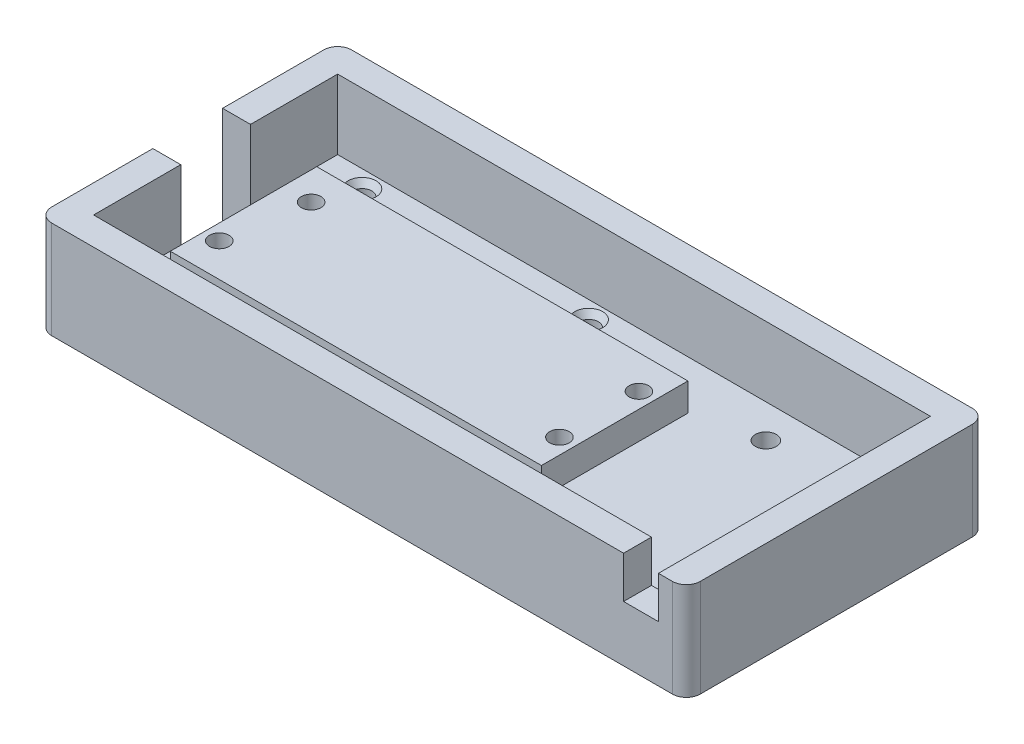
from build123d import *
from OCP.BRepFilletAPI import BRepFilletAPI_MakeChamfer

# Parameters (mm, degrees)
SKETCH1_W               = 93
SKETCH1_H               = 43
SKETCH1_R               = 1.4
SKETCH1_W_2             = 51
SKETCH1_H_2             = 21
SKETCH1_W_3             = 21
SKETCH1_H_3             = 34
BOSS_EXTRUDE1_DEPTH     = 4
BOSS_EXTRUDE2_OUTLINE_W = 53.222222222
BOSS_EXTRUDE2_OUTLINE_H = 21
BOSS_EXTRUDE2_OUTLINE_R = 1.4
BOSS_EXTRUDE2_DEPTH     = 8
SKETCH1_4_W             = 21
SKETCH1_4_H             = 34
SKETCH1_4_R             = 1.5
BOSS_EXTRUDE3_DEPTH     = 4
CHAMFER1_SIZE           = 0.6
CHAMFER1_SIZE2          = 0.960200717
SKETCH2_W               = 10
SKETCH2_H               = 10
CUT_EXTRUDE1_DEPTH      = 4
BOSS_EXTRUDE4_DEPTH     = 10
FILLET1_R               = 2
SKETCH5_W               = 5
SKETCH5_H               = 4
CUT_EXTRUDE3_DEPTH      = 6


# Read off the part's stored shape, not the designer's step: Boss-Extrude2
with BuildPart() as part:
    # Sketch1 → Boss-Extrude1 (new body)
    with BuildSketch(Plane(origin=(0, 0, 0), x_dir=(1, 0, 0), z_dir=(0, 1, 0))):
        with Locations((46.5, 21.5)):
            Rectangle(SKETCH1_W, SKETCH1_H)
        with Locations(Location((10, 36.5, 0), (0, 0, 270))):
            Circle(SKETCH1_R, mode=Mode.SUBTRACT)
        with Locations(Location((42.5, 36.5, 0), (0, 0, 270))):
            Circle(SKETCH1_R, mode=Mode.SUBTRACT)
        with Locations(Location((42.5, 6.5, 0), (0, 0, 270))):
            Circle(SKETCH1_R, mode=Mode.SUBTRACT)
        with Locations(Location((10, 6.5, 0), (0, 0, 270))):
            Circle(SKETCH1_R, mode=Mode.SUBTRACT)
        with Locations((35.5, 21.5)):
            Rectangle(SKETCH1_W_2, SKETCH1_H_2, mode=Mode.SUBTRACT)
        with Locations((77.5, 21.5)):
            Rectangle(SKETCH1_W_3, SKETCH1_H_3, mode=Mode.SUBTRACT)
    extrude(amount=BOSS_EXTRUDE1_DEPTH)

    # Boss-Extrude2 outline → Boss-Extrude2 (add)
    with BuildSketch(Plane(origin=(0, 0, 0), x_dir=(1, 0, 0), z_dir=(0, 1, 0))):
        with Locations((34.611111111, 21.5)):
            Rectangle(BOSS_EXTRUDE2_OUTLINE_W, BOSS_EXTRUDE2_OUTLINE_H)
        with Locations((10.222222222, 15.8)):
            Circle(BOSS_EXTRUDE2_OUTLINE_R, mode=Mode.SUBTRACT)
        with Locations((12, 27.2)):
            Circle(BOSS_EXTRUDE2_OUTLINE_R, mode=Mode.SUBTRACT)
        with Locations((59, 27.2)):
            Circle(BOSS_EXTRUDE2_OUTLINE_R, mode=Mode.SUBTRACT)
        with Locations((59, 15.8)):
            Circle(BOSS_EXTRUDE2_OUTLINE_R, mode=Mode.SUBTRACT)
    extrude(amount=BOSS_EXTRUDE2_DEPTH)

    # Sketch1<4> → Boss-Extrude3 (add)
    with BuildSketch(Plane(origin=(0, 0, 0), x_dir=(1, 0, 0), z_dir=(0, 1, 0))):
        with Locations((77.5, 21.5)):
            Rectangle(SKETCH1_4_W, SKETCH1_4_H)
        with Locations(Location((70.2, 34.2, 0), (0, 0, 270))):
            Circle(SKETCH1_4_R, mode=Mode.SUBTRACT)
        with Locations(Location((84.8, 34.2, 0), (0, 0, 270))):
            Circle(SKETCH1_4_R, mode=Mode.SUBTRACT)
    extrude(amount=BOSS_EXTRUDE3_DEPTH)

    # Chamfer1: one chamfer whose edges measure the first distance from different faces: ONE call of the kernel's chamfer builder (chamfer() names one face for all edges)
    chamfer1_edges_1 = [part.edges().sort_by_distance(p)[0] for p in [
        (42.5, 4, -7.9),
    ]]
    chamfer1_side_1 = [part.faces().sort_by_distance(p)[0] for p in [
        (42.5, 2, -7.9),
    ]]
    chamfer1_edges_2 = [part.edges().sort_by_distance(p)[0] for p in [
        (42.5, 4, -37.9),
        (10, 4, -37.9),
    ]]
    chamfer1_side_2 = [part.faces().sort_by_distance(p)[0] for p in [
        (46.5, 4, -1.024597482),
    ]]
    chamfer1_edges_3 = [part.edges().sort_by_distance(p)[0] for p in [
        (10, 4, -7.9),
    ]]
    chamfer1_side_3 = [part.faces().sort_by_distance(p)[0] for p in [
        (10, 2, -7.9),
    ]]
    chamfer1 = BRepFilletAPI_MakeChamfer(part.part.solid().wrapped)
    for e in chamfer1_edges_1:
        chamfer1.Add(CHAMFER1_SIZE, CHAMFER1_SIZE2, e.wrapped, chamfer1_side_1[0].wrapped)  # the first distance lies on this face
    for e in chamfer1_edges_2:
        chamfer1.Add(CHAMFER1_SIZE, CHAMFER1_SIZE2, e.wrapped, chamfer1_side_2[0].wrapped)  # the first distance lies on this face
    for e in chamfer1_edges_3:
        chamfer1.Add(CHAMFER1_SIZE, CHAMFER1_SIZE2, e.wrapped, chamfer1_side_3[0].wrapped)  # the first distance lies on this face
    add(Compound.cast(chamfer1.Shape()), mode=Mode.REPLACE)

    # Sketch2 → Cut-Extrude1 (cut)
    with BuildSketch(Plane.XZ):
        with Locations((5, -21.5)):
            Rectangle(SKETCH2_W, SKETCH2_H)
    extrude(amount=-CUT_EXTRUDE1_DEPTH, mode=Mode.SUBTRACT)

    # Sketch3 → Boss-Extrude4 (add)
    with BuildSketch(Plane(origin=(0, 4, 0), x_dir=(1, 0, 0), z_dir=(0, 1, 0))):
        Polygon((4, 39), (4, 26.5), (0, 26.5), (0, 43), (93, 43), (93, 0), (0, 0), (0, 16.5), (4, 16.5), (4, 4), (89, 4), (89, 39), align=None)
    extrude(amount=BOSS_EXTRUDE4_DEPTH)

    # Fillet1
    fillet1_edges = [part.edges().sort_by_distance(p)[0] for p in [
        (0, 7, 0),
        (0, 7, -43),
        (93, 7, -43),
        (93, 7, 0),
    ]]
    fillet(fillet1_edges, radius=FILLET1_R)

    # Sketch5 → Cut-Extrude3 (cut)
    with BuildSketch(Plane(origin=(0, 14, 0), x_dir=(1, 0, 0), z_dir=(0, 1, 0))):
        with Locations((86.5, 2)):
            Rectangle(SKETCH5_W, SKETCH5_H)
    extrude(amount=-CUT_EXTRUDE3_DEPTH, mode=Mode.SUBTRACT)


solid = part.part
